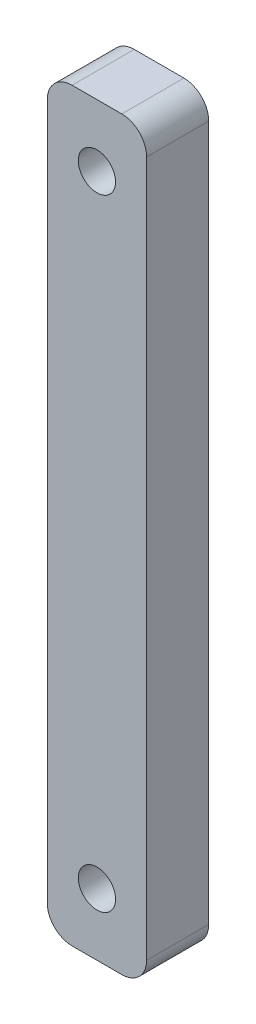
from build123d import *

# Parameters (mm, degrees)
SKETCH_1_W          = 8
SKETCH_1_H          = 60
EXTRUDE_1_DEPTH     = 5
SKETCH_2_R          = 1.5
CUT_EXTRUDE_1_DEPTH = 31.6757233
FILLET_1_R          = 2


with BuildPart() as part:
    # 草图1 → 凸台-拉伸1 (new body)
    with BuildSketch(Plane.XY):
        Rectangle(SKETCH_1_W, SKETCH_1_H)
    extrude(amount=EXTRUDE_1_DEPTH)

    # 草图2 → 切除-拉伸1 (cut, through all)
    with BuildSketch(Plane.XY.offset(5)):
        with Locations((0, 25)):
            Circle(SKETCH_2_R)
        with Locations((0, -25)):
            Circle(SKETCH_2_R)
    extrude(amount=-CUT_EXTRUDE_1_DEPTH, mode=Mode.SUBTRACT)

    # 圆角1
    fillet_1_edges = [part.edges().sort_by_distance(p)[0] for p in [
        (-4, -30, 2.5),
        (4, -30, 2.5),
        (4, 30, 2.5),
        (-4, 30, 2.5),
    ]]
    fillet(fillet_1_edges, radius=FILLET_1_R)


solid = part.part
